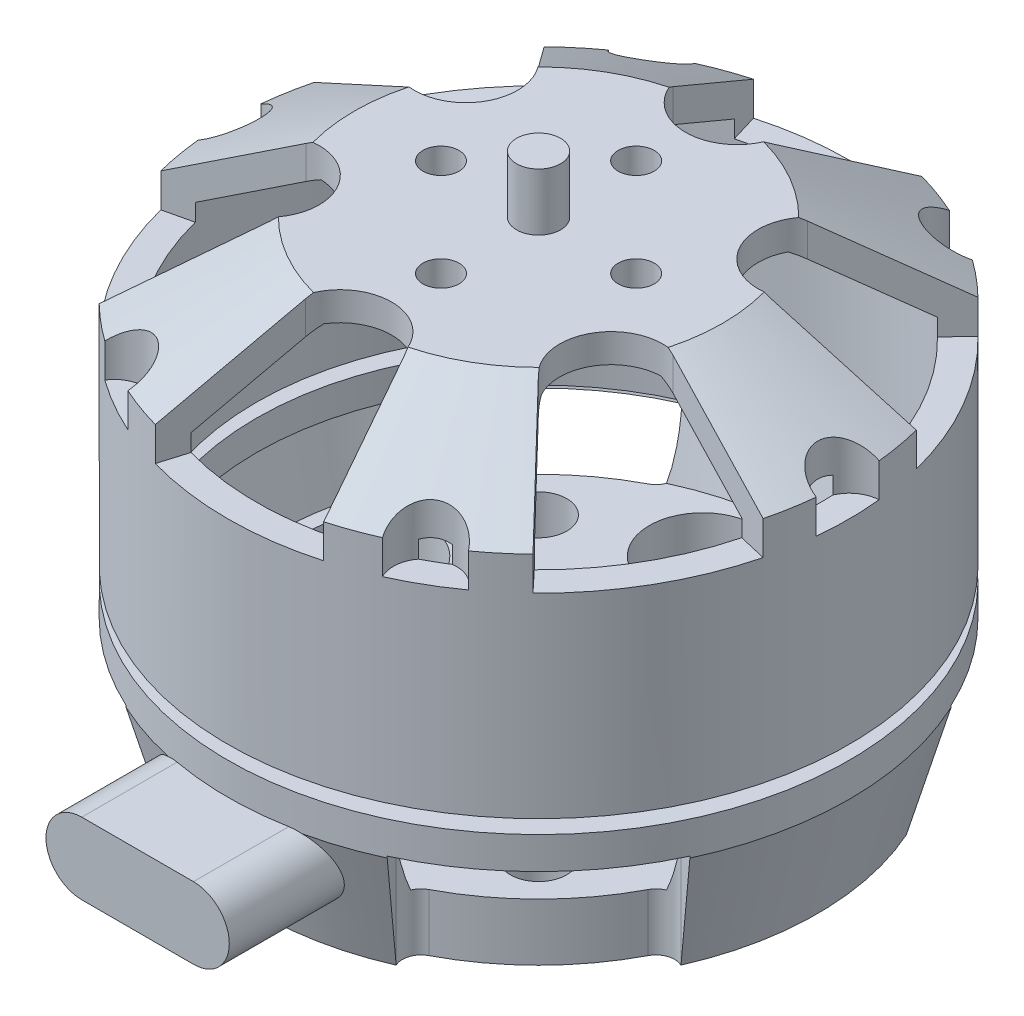
from build123d import *

# Parameters (mm, degrees)
SHELL2_T                   = -1.27
CUT_EXTRUDE1_START         = -5.1816
CUT_EXTRUDE1_DEPTH         = 5.1816
CUT_EXTRUDE2_REACH         = 26.739
SKETCH4_R                  = 12.5095
BOSS_EXTRUDE3_START        = -1.27
BOSS_EXTRUDE3_DEPTH        = 1.27
SKETCH6_R                  = 8.15975
BOSS_EXTRUDE4_DEPTH        = 1.27
SKETCH7_R                  = 1.397
CUT_EXTRUDE3_DEPTH         = 4.699
SKETCH8_W                  = 1.25
SKETCH8_H                  = 2.54
M3_TAPPED_HOLE1_AT_2_COUNT = 2
M3_TAPPED_HOLE1_AT_2_PITCH = 15.6845
M3_TAPPED_HOLE1_AT_3_COUNT = 2
M3_TAPPED_HOLE1_AT_3_PITCH = 12.191545239
M3_TAPPED_HOLE1_AT_4_COUNT = 2
M3_TAPPED_HOLE1_AT_4_PITCH = 12.191545239
M2_START                   = 18
M2_TAPPED_HOLE1_OUTLINE_R  = 0.8
M2_TAPPED_HOLE1_DEPTH      = 4
SKETCH13_R                 = 0.9779
BOSS_EXTRUDE5_DEPTH        = 2.54
BOSS_EXTRUDE7_START        = 11.43
BOSS_EXTRUDE7_DEPTH        = 6.35


with BuildPart() as part:
    # Sketch2 → Revolve1 (revolve)
    with BuildSketch(Plane.XY, mode=Mode.PRIVATE) as revolve1_sk:
        Polygon((0, 0), (12.36345, 0), (13.7795, 5.1054), (13.7795, 6.604), (11.2395, 6.604), (11.2395, 7.2136), (13.7795, 7.2136), (13.7795, 17.3736), (8.15975, 20.574), (0, 20.574), align=None)
    revolve(revolve1_sk.sketch.rotate(Axis((0, 20.574, 0), (0, -1, 0)), 180), axis=Axis((0, 20.574, 0), (0, -1, 0)))

    # Shell2
    shell2_openings = [part.faces().sort_by_distance(p)[0] for p in [
        (0, 20.574, 0),
    ]]
    offset(amount=SHELL2_T, openings=shell2_openings, kind=Kind.INTERSECTION)

    # Cut-Extrude1: read off the stored shape, not the designer's step
    # Cut-Extrude1 outline → Cut-Extrude1 (cut)
    with BuildSketch(Plane.XZ.offset(CUT_EXTRUDE1_START)):
        with BuildLine():
            ThreePointArc((-6.315224612, 1.00345847), (-8.277465928, 3.707083203), (-10.981090661, 1.744841887))
            ThreePointArc((-10.981090661, 1.744841887), (-11.11885, 0), (-10.981090661, -1.744841887))
            ThreePointArc((-10.981090661, -1.744841887), (-8.277465928, -3.707083203), (-6.315224612, -1.00345847))
            ThreePointArc((-6.315224612, -1.00345847), (-6.39445, 0), (-6.315224612, 1.00345847))
        make_face()
        with BuildLine():
            ThreePointArc((1.00345847, 6.315224612), (3.707083203, 8.277465928), (1.744841887, 10.981090661))
            ThreePointArc((1.744841887, 10.981090661), (0, 11.11885), (-1.744841887, 10.981090661))
            ThreePointArc((-1.744841887, 10.981090661), (-3.707083203, 8.277465928), (-1.00345847, 6.315224612))
            ThreePointArc((-1.00345847, 6.315224612), (0, 6.39445), (1.00345847, 6.315224612))
        make_face()
        with BuildLine():
            ThreePointArc((6.315224612, -1.00345847), (8.277465928, -3.707083203), (10.981090661, -1.744841887))
            ThreePointArc((10.981090661, -1.744841887), (11.11885, 0), (10.981090661, 1.744841887))
            ThreePointArc((10.981090661, 1.744841887), (8.277465928, 3.707083203), (6.315224612, 1.00345847))
            ThreePointArc((6.315224612, 1.00345847), (6.39445, 0), (6.315224612, -1.00345847))
        make_face()
        with BuildLine():
            ThreePointArc((-1.00345847, -6.315224612), (-3.707083203, -8.277465928), (-1.744841887, -10.981090661))
            ThreePointArc((-1.744841887, -10.981090661), (0, -11.11885), (1.744841887, -10.981090661))
            ThreePointArc((1.744841887, -10.981090661), (3.707083203, -8.277465928), (1.00345847, -6.315224612))
            ThreePointArc((1.00345847, -6.315224612), (0, -6.39445), (-1.00345847, -6.315224612))
        make_face()
        with BuildLine():
            Line((-5.791454898, -12.503346369), (-5.009994838, -11.33297392))
            ThreePointArc((-5.009994838, -11.33297392), (-4.953074519, -10.703732795), (-5.357766444, -10.218543386))
            ThreePointArc((-5.357766444, -10.218543386), (-8.158562686, -8.158562686), (-10.218543388, -5.357766441))
            ThreePointArc((-10.218543388, -5.357766441), (-10.703732797, -4.953074519), (-11.33297392, -5.009994838))
            Line((-11.33297392, -5.009994838), (-12.503346369, -5.791454898))
            ThreePointArc((-12.503346369, -5.791454898), (-9.743577891, -9.743577891), (-5.791454898, -12.503346369))
        make_face()
        with BuildLine():
            Line((5.10681701, -11.477981973), (5.791454898, -12.503346369))
            ThreePointArc((5.791454898, -12.503346369), (9.743577891, -9.743577891), (12.503346369, -5.791454898))
            Line((12.503346369, -5.791454898), (11.477981973, -5.10681701))
            ThreePointArc((11.477981973, -5.10681701), (10.788330572, -4.931510777), (10.218543386, -5.357766444))
            ThreePointArc((10.218543386, -5.357766444), (8.158562686, -8.158562686), (5.357766441, -10.218543388))
            ThreePointArc((5.357766441, -10.218543388), (4.931510776, -10.788330573), (5.10681701, -11.477981973))
        make_face()
        with BuildLine():
            ThreePointArc((-5.791454898, 12.503346369), (-9.743577891, 9.743577891), (-12.503346369, 5.791454898))
            Line((-12.503346369, 5.791454898), (-11.47798216, 5.106817165))
            ThreePointArc((-11.47798216, 5.106817165), (-10.788330691, 4.931510753), (-10.218543386, 5.357766444))
            ThreePointArc((-10.218543386, 5.357766444), (-8.158562686, 8.158562686), (-5.357766441, 10.218543388))
            ThreePointArc((-5.357766441, 10.218543388), (-4.931510753, 10.788330692), (-5.106817165, 11.47798216))
            Line((-5.106817165, 11.47798216), (-5.791454898, 12.503346369))
        make_face()
        with BuildLine():
            ThreePointArc((12.503346369, 5.791454898), (9.743577891, 9.743577891), (5.791454898, 12.503346369))
            Line((5.791454898, 12.503346369), (5.009994838, 11.33297392))
            ThreePointArc((5.009994838, 11.33297392), (4.953074519, 10.703732795), (5.357766444, 10.218543386))
            ThreePointArc((5.357766444, 10.218543386), (8.158562686, 8.158562686), (10.218543388, 5.357766441))
            ThreePointArc((10.218543388, 5.357766441), (10.703732797, 4.953074519), (11.33297392, 5.009994838))
            Line((11.33297392, 5.009994838), (12.503346369, 5.791454898))
        make_face()
    extrude(amount=CUT_EXTRUDE1_DEPTH, mode=Mode.SUBTRACT)

    # Sketch4 → Cut-Extrude2 (cut, up to next)
    with BuildSketch(Plane.XZ.offset(-5.334), mode=Mode.PRIVATE) as cut_extrude2_sk1:
        with Locations(Location((0, 0, 0), (0, 0, 180))):
            Circle(SKETCH4_R)
    cut_extrude2_tool1 = extrude(cut_extrude2_sk1.sketch, amount=-CUT_EXTRUDE2_REACH, mode=Mode.PRIVATE) & part.part
    add(cut_extrude2_tool1.solids().sort_by_distance((0, 5.334, 0))[0], mode=Mode.SUBTRACT)


with BuildPart() as cut_extrude2_piece_1:
    # of the separate pieces the step leaves, piece 1, a body of its own (cut_extrude2_pieces)
    add(part.part.solids().sort_by_distance((-12.5095, 8.4836, 0))[0])

    # Sketch6 → Boss-Extrude4 (add)
    with BuildSketch(Plane(origin=(0, 20.574, 0), x_dir=(1, 0, 0), z_dir=(0, 1, 0))):
        Circle(SKETCH6_R)
    extrude(amount=-BOSS_EXTRUDE4_DEPTH)

    # Sketch7 → Cut-Extrude3 (cut)
    with BuildSketch(Plane(origin=(0, 20.574, 0), x_dir=(1, 0, 0), z_dir=(0, 1, 0))):
        with Locations((6.88975, 11.933397051)):
            Circle(SKETCH7_R)
        with Locations((13.7795, 0)):
            Circle(SKETCH7_R)
        with Locations((6.88975, -11.933397051)):
            Circle(SKETCH7_R)
        with Locations((-6.88975, -11.933397051)):
            Circle(SKETCH7_R)
        with Locations((-13.7795, 0)):
            Circle(SKETCH7_R)
        with Locations((-6.88975, 11.933397051)):
            Circle(SKETCH7_R)
        with BuildLine():
            Line((-2.188464653, 8.140480245), (-3.890684447, 13.7795))
            Line((-3.890684447, 13.7795), (3.890684447, 13.7795))
            Line((3.890684447, 13.7795), (2.188464653, 8.140480245))
            ThreePointArc((2.188464653, 8.140480245), (0, 6.5151), (-2.188464653, 8.140480245))
        make_face()
        with BuildLine():
            Line((5.955630364, 5.965506107), (9.988054828, 10.25918157))
            Line((9.988054828, 10.25918157), (13.878739275, 3.52031843))
            Line((13.878739275, 3.52031843), (8.144095017, 2.174974137))
            ThreePointArc((8.144095017, 2.174974137), (5.642242108, 3.25755), (5.955630364, 5.965506107))
        make_face()
        with BuildLine():
            Line((8.144095017, -2.174974137), (13.878739275, -3.52031843))
            Line((13.878739275, -3.52031843), (9.988054828, -10.25918157))
            Line((9.988054828, -10.25918157), (5.955630364, -5.965506107))
            ThreePointArc((5.955630364, -5.965506107), (5.642242108, -3.25755), (8.144095017, -2.174974137))
        make_face()
        with BuildLine():
            Line((2.188464653, -8.140480245), (3.890684447, -13.7795))
            Line((3.890684447, -13.7795), (-3.890684447, -13.7795))
            Line((-3.890684447, -13.7795), (-2.188464653, -8.140480245))
            ThreePointArc((-2.188464653, -8.140480245), (0, -6.5151), (2.188464653, -8.140480245))
        make_face()
        with BuildLine():
            Line((-5.955630364, -5.965506107), (-9.988054828, -10.25918157))
            Line((-9.988054828, -10.25918157), (-13.878739275, -3.52031843))
            Line((-13.878739275, -3.52031843), (-8.144095017, -2.174974137))
            ThreePointArc((-8.144095017, -2.174974137), (-5.642242108, -3.25755), (-5.955630364, -5.965506107))
        make_face()
        with BuildLine():
            Line((-8.144095017, 2.174974137), (-13.878739275, 3.52031843))
            Line((-13.878739275, 3.52031843), (-9.988054828, 10.25918157))
            Line((-9.988054828, 10.25918157), (-5.955630364, 5.965506107))
            ThreePointArc((-5.955630364, 5.965506107), (-5.642242108, 3.25755), (-8.144095017, 2.174974137))
        make_face()
    extrude(amount=-CUT_EXTRUDE3_DEPTH, mode=Mode.SUBTRACT)

    # M2 Tapped Hole1: read off the stored shape, not the designer's step
    # M2 Tapped Hole1 outline → M2 Tapped Hole1 (cut)
    with BuildSketch(Plane(origin=(0, 0, 0), x_dir=(1, 0, 0), z_dir=(0, 1, 0)).offset(M2_START)):
        with Locations((-4.32848345, 0)):
            Circle(M2_TAPPED_HOLE1_OUTLINE_R)
        with Locations((0, -4.32848345)):
            Circle(M2_TAPPED_HOLE1_OUTLINE_R)
        with Locations((4.32848345, 0)):
            Circle(M2_TAPPED_HOLE1_OUTLINE_R)
        with Locations((0, 4.32848345)):
            Circle(M2_TAPPED_HOLE1_OUTLINE_R)
    extrude(amount=M2_TAPPED_HOLE1_DEPTH, mode=Mode.SUBTRACT)

    # Sketch13 → Boss-Extrude5 (add)
    with BuildSketch(Plane(origin=(0, 20.574, 0), x_dir=(1, 0, 0), z_dir=(0, 1, 0))):
        Circle(SKETCH13_R)
    extrude(amount=BOSS_EXTRUDE5_DEPTH)


with BuildPart() as cut_extrude2_piece_2:
    # of the separate pieces the step leaves, piece 2, a body of its own (cut_extrude2_pieces)
    add(part.part.solids().sort_by_distance((-10.218543388, 0, -5.357766441))[0])

    # Sketch5 → Boss-Extrude3 (add)
    with BuildSketch(Plane.XZ.offset(BOSS_EXTRUDE3_START)):
        with BuildLine():
            ThreePointArc((-5.357766441, 10.218543388), (-8.158562686, 8.158562686), (-10.218543388, 5.357766441))
            ThreePointArc((-10.218543388, 5.357766441), (-10.690611308, 4.957289757), (-11.308352658, 4.997605034))
            ThreePointArc((-11.308352658, 4.997605034), (-12.36345, 0), (-11.308352658, -4.997605034))
            ThreePointArc((-11.308352658, -4.997605034), (-10.690611308, -4.957289757), (-10.218543388, -5.357766441))
            ThreePointArc((-10.218543388, -5.357766441), (-8.158562686, -8.158562686), (-5.357766441, -10.218543388))
            ThreePointArc((-5.357766441, -10.218543388), (-4.957289757, -10.690611308), (-4.997605034, -11.308352658))
            ThreePointArc((-4.997605034, -11.308352658), (0, -12.36345), (4.997605034, -11.308352658))
            ThreePointArc((4.997605034, -11.308352658), (4.957289757, -10.690611308), (5.357766441, -10.218543388))
            ThreePointArc((5.357766441, -10.218543388), (8.158562686, -8.158562686), (10.218543388, -5.357766441))
            ThreePointArc((10.218543388, -5.357766441), (10.690611308, -4.957289757), (11.308352658, -4.997605034))
            ThreePointArc((11.308352658, -4.997605034), (12.36345, 0), (11.308352658, 4.997605034))
            ThreePointArc((11.308352658, 4.997605034), (10.690611308, 4.957289757), (10.218543388, 5.357766441))
            ThreePointArc((10.218543388, 5.357766441), (8.158562686, 8.158562686), (5.357766441, 10.218543388))
            ThreePointArc((5.357766441, 10.218543388), (4.957289757, 10.690611308), (4.997605034, 11.308352658))
            ThreePointArc((4.997605034, 11.308352658), (0, 12.36345), (-4.997605034, 11.308352658))
            ThreePointArc((-4.997605034, 11.308352658), (-4.957289757, 10.690611308), (-5.357766441, 10.218543388))
        make_face()
        with BuildLine():
            ThreePointArc((6.315224612, -1.00345847), (6.39445, 0), (6.315224612, 1.00345847))
            ThreePointArc((6.315224612, 1.00345847), (8.277465928, 3.707083203), (10.981090661, 1.744841887))
            ThreePointArc((10.981090661, 1.744841887), (11.11885, 0), (10.981090661, -1.744841887))
            ThreePointArc((10.981090661, -1.744841887), (8.277465928, -3.707083203), (6.315224612, -1.00345847))
        make_face(mode=Mode.SUBTRACT)
        with BuildLine():
            ThreePointArc((-1.00345847, -6.315224612), (0, -6.39445), (1.00345847, -6.315224612))
            ThreePointArc((1.00345847, -6.315224612), (3.707083203, -8.277465928), (1.744841887, -10.981090661))
            ThreePointArc((1.744841887, -10.981090661), (0, -11.11885), (-1.744841887, -10.981090661))
            ThreePointArc((-1.744841887, -10.981090661), (-3.707083203, -8.277465928), (-1.00345847, -6.315224612))
        make_face(mode=Mode.SUBTRACT)
        with BuildLine():
            ThreePointArc((-6.315224612, 1.00345847), (-6.39445, 0), (-6.315224612, -1.00345847))
            ThreePointArc((-6.315224612, -1.00345847), (-8.277465928, -3.707083203), (-10.981090661, -1.744841887))
            ThreePointArc((-10.981090661, -1.744841887), (-11.11885, 0), (-10.981090661, 1.744841887))
            ThreePointArc((-10.981090661, 1.744841887), (-8.277465928, 3.707083203), (-6.315224612, 1.00345847))
        make_face(mode=Mode.SUBTRACT)
        with BuildLine():
            ThreePointArc((1.00345847, 6.315224612), (0, 6.39445), (-1.00345847, 6.315224612))
            ThreePointArc((-1.00345847, 6.315224612), (-3.707083203, 8.277465928), (-1.744841887, 10.981090661))
            ThreePointArc((-1.744841887, 10.981090661), (0, 11.11885), (1.744841887, 10.981090661))
            ThreePointArc((1.744841887, 10.981090661), (3.707083203, 8.277465928), (1.00345847, 6.315224612))
        make_face(mode=Mode.SUBTRACT)
    extrude(amount=-BOSS_EXTRUDE3_DEPTH)

    # Sketch8 → M3 Tapped Hole1 (revolve, cut)
    with BuildSketch(Plane(origin=(-5.545308155, 0, 5.545308155), x_dir=(0, 0, -1), z_dir=(1, 0, 0))):
        with Locations((0.625, 1.27)):
            Rectangle(SKETCH8_W, SKETCH8_H)
    m3_tapped_hole1 = revolve(axis=Axis((-5.545308155, -6.35, 5.545308155), (0, 1, 0)), mode=Mode.SUBTRACT)

    # M3 Tapped Hole1 at 2: M3 Tapped Hole1 ×2
    with Locations(*[Vector(0.7071067811865464, 0, -0.7071067811865487) * (i * M3_TAPPED_HOLE1_AT_2_PITCH) for i in range(1, M3_TAPPED_HOLE1_AT_2_COUNT)]):
        add(m3_tapped_hole1, mode=Mode.SUBTRACT)

    # M3 Tapped Hole1 at 3: M3 Tapped Hole1 ×2
    with Locations(*[Vector(0.9962474949424386, 0, 0.0865501520559956) * (i * M3_TAPPED_HOLE1_AT_3_PITCH) for i in range(1, M3_TAPPED_HOLE1_AT_3_COUNT)]):
        add(m3_tapped_hole1, mode=Mode.SUBTRACT)

    # M3 Tapped Hole1 at 4: M3 Tapped Hole1 ×2
    with Locations(*[Vector(-0.0865501520559986, 0, -0.9962474949424382) * (i * M3_TAPPED_HOLE1_AT_4_PITCH) for i in range(1, M3_TAPPED_HOLE1_AT_4_COUNT)]):
        add(m3_tapped_hole1, mode=Mode.SUBTRACT)

    # Sketch14 → Boss-Extrude7 (add)
    with BuildSketch(Plane.XY.offset(BOSS_EXTRUDE7_START)):
        with BuildLine():
            Line((-2.4765, 5.1816), (2.4765, 5.1816))
            ThreePointArc((2.4765, 5.1816), (4.064, 3.5941), (2.4765, 2.0066))
            Line((2.4765, 2.0066), (-2.4765, 2.0066))
            ThreePointArc((-2.4765, 2.0066), (-4.064, 3.5941), (-2.4765, 5.1816))
        make_face()
    extrude(amount=BOSS_EXTRUDE7_DEPTH)


solid = Compound([cut_extrude2_piece_1.part, cut_extrude2_piece_2.part])
